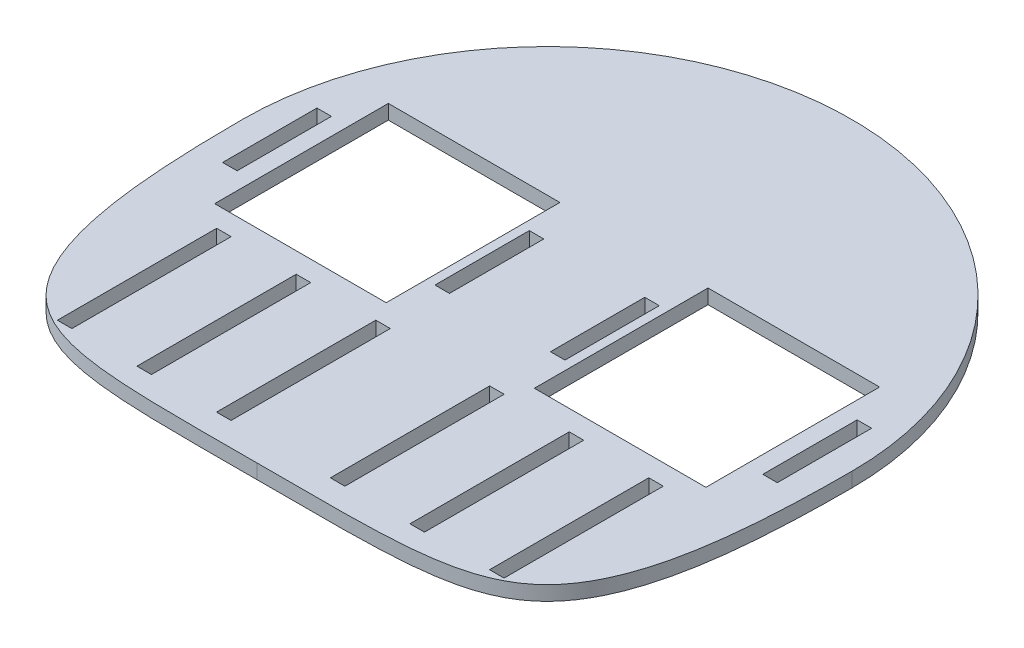
from build123d import *

# Parameters (mm, degrees)
BASE_DEPTH          = 6.35
SKETCH6_W           = 75.0815
SKETCH6_H           = 76
SKETCH6_W_2         = 6.35
SKETCH6_H_2         = 41.275
WHEELSHAFTCUT_DEPTH = 189.692256213
SKETCH8_W           = 6.35
SKETCH8_H           = 69.7
CUT_EXTRUDE3_DEPTH  = 189.692256213


with BuildPart() as part:
    # Sketch1 → Base (new body)
    with BuildSketch(Plane(origin=(0, 0, 0), x_dir=(1, 0, 0), z_dir=(0, 1, 0))):
        with BuildLine():
            ThreePointArc((133.35, 0), (0, 133.35), (-133.35, 0))
            add(Edge.make_bspline(
                [(-133.35, 0), (-133.35, -51.197979728), (-123.803376308, -129.805052089), (-58.427993604, -127), (0, -127)],
                knots=[0, 0, 0, 0, 0.502616309, 1, 1, 1, 1], degree=3))
            add(Edge.make_bspline(
                [(133.35, 0), (133.35, -51.197979728), (123.803376308, -129.805052089), (58.427993604, -127), (0, -127)],
                knots=[0, 0, 0, 0, 0.502616309, 1, 1, 1, 1], degree=3))
        make_face()
    extrude(amount=BASE_DEPTH)

    # Sketch6 → WheelShaftCut (cut, through all)
    with BuildSketch(Plane(origin=(0, 6.35, 0), x_dir=(1, 0, 0), z_dir=(0, 1, 0))):
        with Locations((-69.957348141, 0)):
            Rectangle(SKETCH6_W, SKETCH6_H)
        with Locations((-118.197848141, 0)):
            Rectangle(SKETCH6_W_2, SKETCH6_H_2)
        with Locations((-25.272848141, 0)):
            Rectangle(SKETCH6_W_2, SKETCH6_H_2)
        with Locations((25.272848141, 0)):
            Rectangle(SKETCH6_W_2, SKETCH6_H_2)
        with Locations((118.197848141, 0)):
            Rectangle(SKETCH6_W_2, SKETCH6_H_2)
        with Locations((69.957348141, 0)):
            Rectangle(SKETCH6_W, SKETCH6_H)
    extrude(amount=-WHEELSHAFTCUT_DEPTH, mode=Mode.SUBTRACT)

    # Sketch8 → Cut-Extrude3 (cut, through all)
    with BuildSketch(Plane(origin=(0, 6.35, 0), x_dir=(1, 0, 0), z_dir=(0, 1, 0))):
        with Locations((-24.910348141, -81.74)):
            Rectangle(SKETCH8_W, SKETCH8_H)
        with Locations((-59.735348141, -81.74)):
            Rectangle(SKETCH8_W, SKETCH8_H)
        with Locations((-94.560348141, -81.74)):
            Rectangle(SKETCH8_W, SKETCH8_H)
        with Locations((94.560348141, -81.74)):
            Rectangle(SKETCH8_W, SKETCH8_H)
        with Locations((59.735348141, -81.74)):
            Rectangle(SKETCH8_W, SKETCH8_H)
        with Locations((24.910348141, -81.74)):
            Rectangle(SKETCH8_W, SKETCH8_H)
    extrude(amount=-CUT_EXTRUDE3_DEPTH, mode=Mode.SUBTRACT)


solid = part.part
